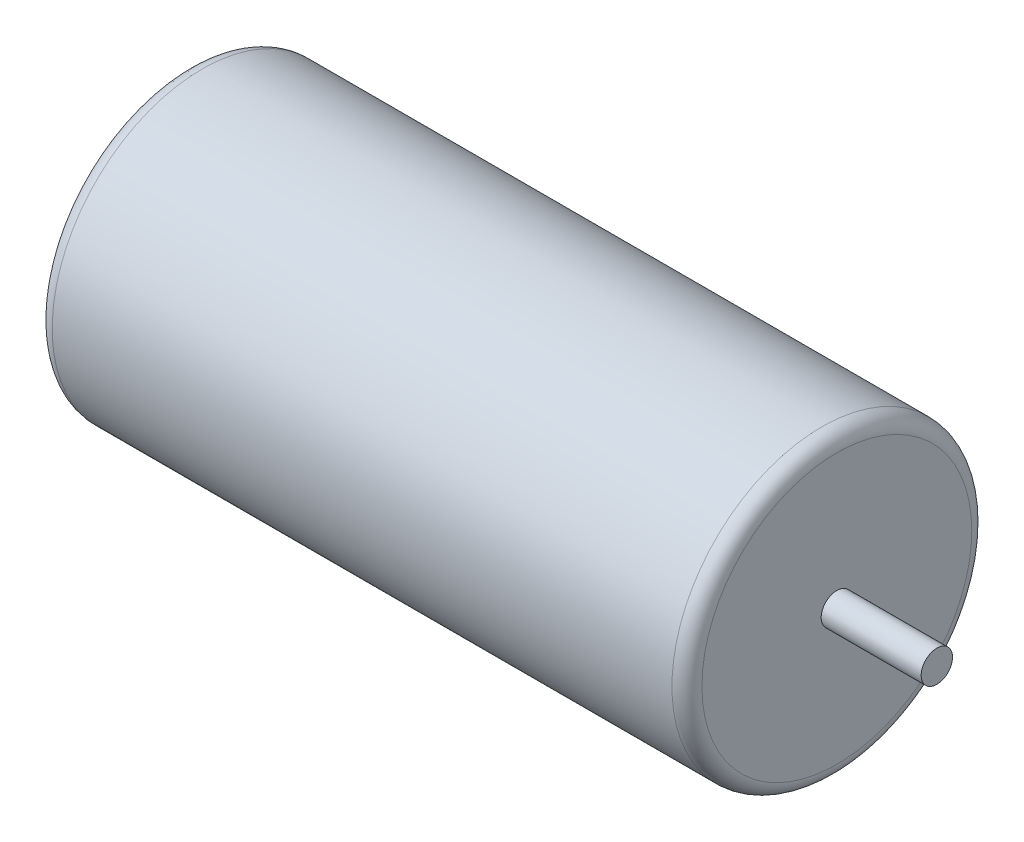
from build123d import *

# Parameters (mm, degrees)
SKETCH1_R           = 38.1
BOSS_EXTRUDE1_DEPTH = 165.1
SKETCH2_R           = 3.9878
BOSS_EXTRUDE2_DEPTH = 25.4
FILLET1_R           = 3.81
SHELL2_OUTLINE_R    = 33.02
SHELL2_DEPTH        = 160.02


# Read off the part's stored shape, not the designer's step: Shell2
with BuildPart() as part:
    # Sketch1 → Boss-Extrude1 (new body)
    with BuildSketch(Plane(origin=(0, 0, 0), x_dir=(0, 0, -1), z_dir=(1, 0, 0))):
        Circle(SKETCH1_R)
    extrude(amount=BOSS_EXTRUDE1_DEPTH)

    # Sketch2 → Boss-Extrude2 (add)
    with BuildSketch(Plane(origin=(165.1, 0, 0), x_dir=(0, 0, -1), z_dir=(1, 0, 0))):
        Circle(SKETCH2_R)
    extrude(amount=BOSS_EXTRUDE2_DEPTH)

    # Fillet1
    fillet1_edges = [part.edges().sort_by_distance(p)[0] for p in [
        (0, 0, 38.1),
        (165.1, 0, 38.1),
    ]]
    fillet(fillet1_edges, radius=FILLET1_R)

    # Shell2 outline → Shell2 (cut)
    with BuildSketch(Plane.YZ):
        Circle(SHELL2_OUTLINE_R)
    extrude(amount=SHELL2_DEPTH, mode=Mode.SUBTRACT)


solid = part.part
